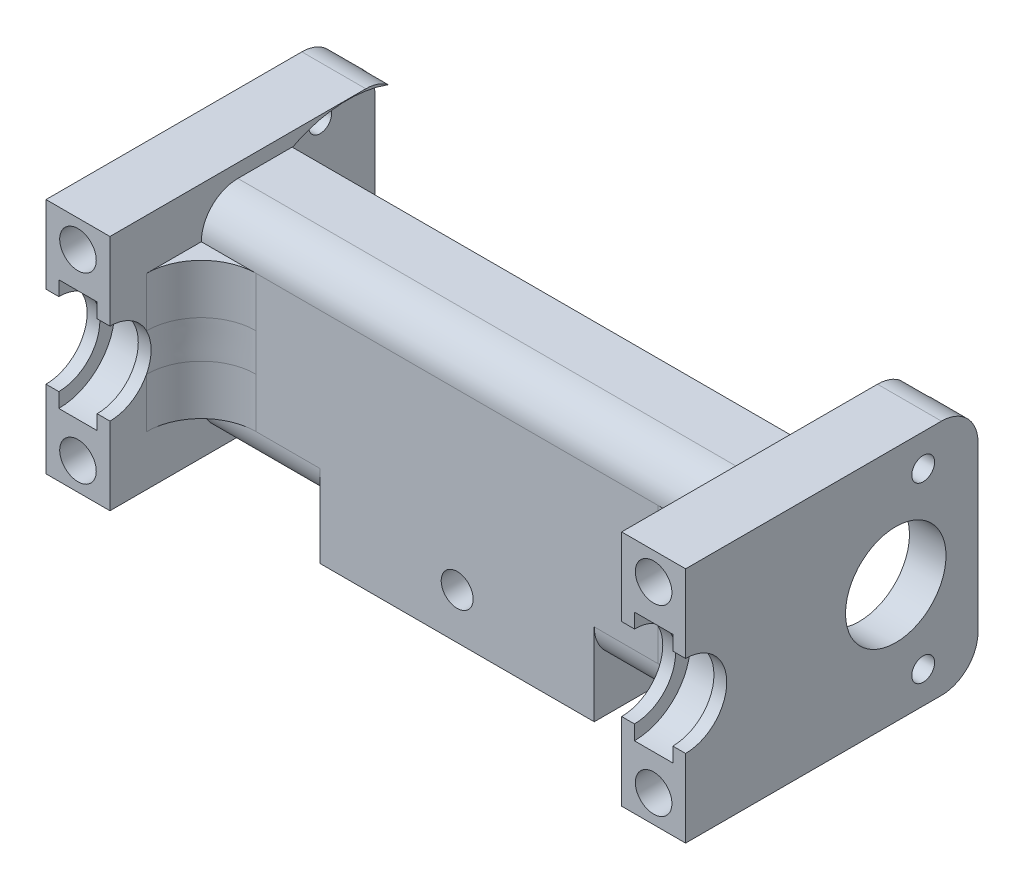
from build123d import *

# Parameters (mm, degrees)
SKETCH1_W                                  = 70
SKETCH1_H                                  = 15
BOSS_EXTRUDE1_DEPTH                        = 3
SKETCH2_W                                  = 7
SKETCH2_H                                  = 15
BOSS_EXTRUDE2_DEPTH                        = 10
SKETCH5_R                                  = 4.5
CUT_EXTRUDE1_DEPTH                         = 72.590851371
SKETCH6_R                                  = 6.1
CUT_EXTRUDE4_DEPTH                         = 2.1
BOSS_EXTRUDE3_DEPTH                        = 13
SKETCH8_R                                  = 2
CUT_EXTRUDE5_DEPTH                         = 40.534794802
SKETCH9_R                                  = 1.75
CUT_EXTRUDE6_DEPTH                         = 39.65229618
MIRROR1_AT_THE_SECOND_PLANE_COPY_1_SKETC_R = 6.1
MIRROR1_AT_THE_SECOND_PLANE_COPY_1_DEPTH   = 2.1
MIRROR1_AT_THE_SECOND_PLANE_COPY_2_DEPTH   = 13
MIRROR1_AT_THE_SECOND_PLANE_COPY_3_SKETC_R = 2
MIRROR1_AT_THE_SECOND_PLANE_COPY_3_DEPTH   = 40.534794802
MIRROR1_AT_THE_SECOND_PLANE_COPY_4_SKETC_R = 1.75
MIRROR1_AT_THE_SECOND_PLANE_COPY_4_DEPTH   = 39.65229618
FILLET1_R                                  = 6
SKETCH10_W                                 = 56
SKETCH10_H                                 = 23
BOSS_EXTRUDE4_DEPTH                        = 15
FILLET2_R                                  = 4
SKETCH11_R                                 = 13
CUT_EXTRUDE7_DEPTH                         = 66.627738058
SKETCH14_W                                 = 7
SKETCH14_H                                 = 26
BOSS_EXTRUDE6_DEPTH                        = 5
SKETCH15_W                                 = 7
SKETCH15_H                                 = 26
BOSS_EXTRUDE7_DEPTH                        = 14
FILLET5_R                                  = 4
SKETCH16_R                                 = 5.5
CUT_EXTRUDE9_DEPTH                         = 74.688533708
FILLET5_OF_MIRROR2_R                       = 4
SKETCH17_R                                 = 1.25
CUT_EXTRUDE10_DEPTH                        = 74.688533708
CUT_EXTRUDE14_DEPTH                        = 31
CUT_EXTRUDE14_DEPTH_BACK                   = 31
SKETCH18_R                                 = 12.95
SKETCH19_W                                 = 30
SKETCH19_H                                 = 10
BOSS_EXTRUDE8_DEPTH                        = 5
BOSS_EXTRUDE8_DIRECTION_2_REACH            = 48.757
SKETCH20_R                                 = 2
CUT_EXTRUDE15_DEPTH                        = 10
SKETCH21_R                                 = 1.75
CUT_EXTRUDE16_DEPTH                        = 45.511234574


with BuildPart() as part:
    # Sketch1 → Boss-Extrude1 (new body)
    with BuildSketch(Plane.XY):
        Rectangle(SKETCH1_W, SKETCH1_H)
    extrude(amount=BOSS_EXTRUDE1_DEPTH)

    # Sketch2 → Boss-Extrude2 (add)
    with BuildSketch(Plane.XY.offset(3)):
        with Locations((-31.5, 0)):
            Rectangle(SKETCH2_W, SKETCH2_H)
        with Locations((31.5, 0)):
            Rectangle(SKETCH2_W, SKETCH2_H)
    extrude(amount=BOSS_EXTRUDE2_DEPTH)

    # Sketch5 → Cut-Extrude1 (cut, through all)
    with BuildSketch(Plane(origin=(35, 0, 0), x_dir=(0, 0, -1), z_dir=(1, 0, 0))):
        with Locations((-13, 0)):
            Circle(SKETCH5_R)
    extrude(amount=-CUT_EXTRUDE1_DEPTH, mode=Mode.SUBTRACT)

    # Sketch6 → Cut-Extrude4 (cut, symmetric)
    with BuildSketch(Plane(origin=(31.5, 0, 0), x_dir=(0, 0, -1), z_dir=(1, 0, 0))):
        with Locations((-13, 0)):
            Circle(SKETCH6_R)
    cut_extrude4 = extrude(amount=CUT_EXTRUDE4_DEPTH, both=True, mode=Mode.SUBTRACT)

    # Sketch7 → Boss-Extrude3 (add)
    with BuildSketch(Plane.XY):
        Polygon((28, 8.1), (28, 13), (35, 13), (35, 8.1), (35, 4.5), (33.6, 4.5), (33.6, 6.1), (29.4, 6.1), (29.4, 4.5), (28, 4.5), align=None)
    boss_extrude3 = extrude(amount=BOSS_EXTRUDE3_DEPTH)

    # Sketch8 → Cut-Extrude5 (cut, symmetric)
    with BuildSketch(Plane.XY.offset(13)):
        with Locations((31.5, 10)):
            Circle(SKETCH8_R)
    cut_extrude5 = extrude(amount=CUT_EXTRUDE5_DEPTH, both=True, mode=Mode.SUBTRACT)

    # Sketch9 → Cut-Extrude6 (cut, through all)
    with BuildSketch(Plane.XY.offset(3)):
        with Locations((-10, -4)):
            Circle(SKETCH9_R)
    cut_extrude6 = extrude(amount=-CUT_EXTRUDE6_DEPTH, mode=Mode.SUBTRACT)

    # Mirror1: Cut-Extrude4, Boss-Extrude3, Cut-Extrude5, Cut-Extrude6 across plane
    add(cut_extrude4.mirror(Plane(origin=(0, 0, 0), x_dir=(0, 0, 1), z_dir=(1, 0, 0))), mode=Mode.SUBTRACT)
    add(boss_extrude3.mirror(Plane(origin=(0, 0, 0), x_dir=(0, 0, 1), z_dir=(1, 0, 0))))
    add(cut_extrude5.mirror(Plane(origin=(0, 0, 0), x_dir=(0, 0, 1), z_dir=(1, 0, 0))), mode=Mode.SUBTRACT)
    add(cut_extrude6.mirror(Plane(origin=(0, 0, 0), x_dir=(0, 0, 1), z_dir=(1, 0, 0))), mode=Mode.SUBTRACT)

    # Mirror1 at the second plane: Cut-Extrude4, Boss-Extrude3, Cut-Extrude5, Cut-Extrude6 across plane
    add(cut_extrude4.mirror(Plane.ZX), mode=Mode.SUBTRACT)
    add(boss_extrude3.mirror(Plane.ZX))
    add(cut_extrude5.mirror(Plane.ZX), mode=Mode.SUBTRACT)
    add(cut_extrude6.mirror(Plane.ZX), mode=Mode.SUBTRACT)

    # Mirror1 at the second plane copy 1 sketc → Mirror1 at the second plane copy 1 (cut, symmetric)
    with BuildSketch(Plane(origin=(-31.5, 0, 0), x_dir=(0, 0, -1), z_dir=(-1, 0, 0))):
        with Locations((-13, 0)):
            Circle(MIRROR1_AT_THE_SECOND_PLANE_COPY_1_SKETC_R)
    extrude(amount=MIRROR1_AT_THE_SECOND_PLANE_COPY_1_DEPTH, both=True, mode=Mode.SUBTRACT)

    # Mirror1 at the second plane copy 2 sketc → Mirror1 at the second plane copy 2 (add)
    with BuildSketch(Plane(origin=(0, 0, 0), x_dir=(-1, 0, 0), z_dir=(0, 0, 1))):
        Polygon((28, 8.1), (28, 13), (35, 13), (35, 8.1), (35, 4.5), (33.6, 4.5), (33.6, 6.1), (29.4, 6.1), (29.4, 4.5), (28, 4.5), align=None)
    extrude(amount=MIRROR1_AT_THE_SECOND_PLANE_COPY_2_DEPTH)

    # Mirror1 at the second plane copy 3 sketc → Mirror1 at the second plane copy 3 (cut, symmetric)
    with BuildSketch(Plane(origin=(0, 0, 13), x_dir=(-1, 0, 0), z_dir=(0, 0, 1))):
        with Locations((31.5, 10)):
            Circle(MIRROR1_AT_THE_SECOND_PLANE_COPY_3_SKETC_R)
    extrude(amount=MIRROR1_AT_THE_SECOND_PLANE_COPY_3_DEPTH, both=True, mode=Mode.SUBTRACT)

    # Mirror1 at the second plane copy 4 sketc → Mirror1 at the second plane copy 4 (cut, through all)
    with BuildSketch(Plane(origin=(0, 0, 3), x_dir=(-1, 0, 0), z_dir=(0, 0, 1))):
        with Locations((-10, -4)):
            Circle(MIRROR1_AT_THE_SECOND_PLANE_COPY_4_SKETC_R)
    extrude(amount=-MIRROR1_AT_THE_SECOND_PLANE_COPY_4_DEPTH, mode=Mode.SUBTRACT)

    # Fillet1
    fillet1_edges = [part.edges().sort_by_distance(p)[0] for p in [
        (-28, 0, 3),
        (28, 0, 3),
    ]]
    fillet(fillet1_edges, radius=FILLET1_R)

    # Sketch10 → Boss-Extrude4 (add)
    with BuildSketch(Plane(origin=(0, 0, 3), x_dir=(-1, 0, 0), z_dir=(0, 0, -1))):
        Rectangle(SKETCH10_W, SKETCH10_H)
    extrude(amount=BOSS_EXTRUDE4_DEPTH)

    # Fillet2
    # the kernel refuses this fillet: 4 mm, written as the material it takes off along each edge
    with BuildSketch(Plane(origin=(-28, 11.5, 3), x_dir=(0, 0, -1), z_dir=(1, 0, 0)), Plane(origin=(28, -11.5, 3), x_dir=(0, 0, -1), z_dir=(-1, 0, 0))) as fillet2_piece_1:
        with BuildLine():
            CenterArc((FILLET2_R, -FILLET2_R), FILLET2_R, 90, 90)
            Line((0, -FILLET2_R), (0, 0))
            Line((0, 0), (FILLET2_R, 0))
        make_face()
    extrude(amount=56, mode=Mode.SUBTRACT)

    # Sketch11 → Cut-Extrude7 (cut, through all)
    with BuildSketch(Plane(origin=(28, 0, 0), x_dir=(0, 0, -1), z_dir=(1, 0, 0))):
        with Locations((13, 0)):
            Circle(SKETCH11_R)
    extrude(amount=-CUT_EXTRUDE7_DEPTH, mode=Mode.SUBTRACT)

    # Sketch14 → Boss-Extrude6 (add)
    with BuildSketch(Plane(origin=(0, 0, 0), x_dir=(-1, 0, 0), z_dir=(0, 0, -1))):
        with Locations((31.5, 0)):
            Rectangle(SKETCH14_W, SKETCH14_H)
    boss_extrude6 = extrude(amount=BOSS_EXTRUDE6_DEPTH)

    # Sketch15 → Boss-Extrude7 (add)
    with BuildSketch(Plane(origin=(0, 0, -5), x_dir=(-1, 0, 0), z_dir=(0, 0, -1))):
        with Locations((31.5, 0)):
            Rectangle(SKETCH15_W, SKETCH15_H)
    boss_extrude7 = extrude(amount=BOSS_EXTRUDE7_DEPTH)

    # Fillet5
    fillet5_edges = [part.edges().sort_by_distance(p)[0] for p in [
        (-31.5, 13, -19),
        (-31.5, -13, -19),
    ]]
    fillet(fillet5_edges, radius=FILLET5_R)

    # Sketch16 → Cut-Extrude9 (cut, through all)
    with BuildSketch(Plane.ZY.offset(35)):
        with Locations((-10, 0)):
            Circle(SKETCH16_R)
    cut_extrude9 = extrude(amount=-CUT_EXTRUDE9_DEPTH, mode=Mode.SUBTRACT)

    # Mirror2: Boss-Extrude6, Boss-Extrude7, Cut-Extrude9 across plane
    add(boss_extrude6.mirror(Plane(origin=(0, 0, 0), x_dir=(0, 0, 1), z_dir=(1, 0, 0))))
    add(boss_extrude7.mirror(Plane(origin=(0, 0, 0), x_dir=(0, 0, 1), z_dir=(1, 0, 0))))
    add(cut_extrude9.mirror(Plane(origin=(0, 0, 0), x_dir=(0, 0, 1), z_dir=(1, 0, 0))), mode=Mode.SUBTRACT)

    # Fillet5 of Mirror2
    fillet5_of_mirror2_edges = [part.edges().sort_by_distance(p)[0] for p in [
        (31.5, 13, -19),
        (31.5, -13, -19),
    ]]
    fillet(fillet5_of_mirror2_edges, radius=FILLET5_OF_MIRROR2_R)

    # Sketch17 → Cut-Extrude10 (cut, through all)
    with BuildSketch(Plane.ZY.offset(35)):
        with Locations((-13, 9.5)):
            Circle(SKETCH17_R)
        with Locations((-13, -9.5)):
            Circle(SKETCH17_R)
    extrude(amount=-CUT_EXTRUDE10_DEPTH, mode=Mode.SUBTRACT)

    # Sketch18 → Cut-Extrude14 (cut, two sides: drawn at the far end of the back side and taken through both)
    with BuildSketch(Plane(origin=(0, 0, 0), x_dir=(0, 0, -1), z_dir=(1, 0, 0)).offset(-CUT_EXTRUDE14_DEPTH_BACK)):
        with Locations((13, 0)):
            Circle(SKETCH18_R)
    extrude(amount=CUT_EXTRUDE14_DEPTH + CUT_EXTRUDE14_DEPTH_BACK, mode=Mode.SUBTRACT)

    # Sketch19 → Boss-Extrude8 (add)
    with BuildSketch(Plane.XZ.offset(11.5)):
        with Locations((0, -2)):
            Rectangle(SKETCH19_W, SKETCH19_H)
    extrude(amount=BOSS_EXTRUDE8_DEPTH)

    # Sketch19 → Boss-Extrude8 direction 2 (add, up to next)
    with BuildSketch(Plane.XZ.offset(11.5), mode=Mode.PRIVATE) as boss_extrude8_direction_2_sk1:
        with Locations((0, -2)):
            Rectangle(SKETCH19_W, SKETCH19_H)
    boss_extrude8_direction_2_tool1 = extrude(boss_extrude8_direction_2_sk1.sketch, amount=-BOSS_EXTRUDE8_DIRECTION_2_REACH, mode=Mode.PRIVATE) - part.part
    add(boss_extrude8_direction_2_tool1.solids().sort_by_distance((0, -11.5, -2))[0])

    # Sketch20 → Cut-Extrude15 (cut)
    with BuildSketch(Plane.XZ.offset(16.5)):
        with Locations(Location((-8.5, -3, 0), (0, 0, 270))):
            Circle(SKETCH20_R)
        with Locations(Location((8.5, -3, 0), (0, 0, 270))):
            Circle(SKETCH20_R)
    extrude(amount=-CUT_EXTRUDE15_DEPTH, mode=Mode.SUBTRACT)

    # Sketch21 → Cut-Extrude16 (cut, through all)
    with BuildSketch(Plane.XY.offset(3)):
        with Locations((0, -11.5)):
            Circle(SKETCH21_R)
    extrude(amount=-CUT_EXTRUDE16_DEPTH, mode=Mode.SUBTRACT)


solid = part.part
